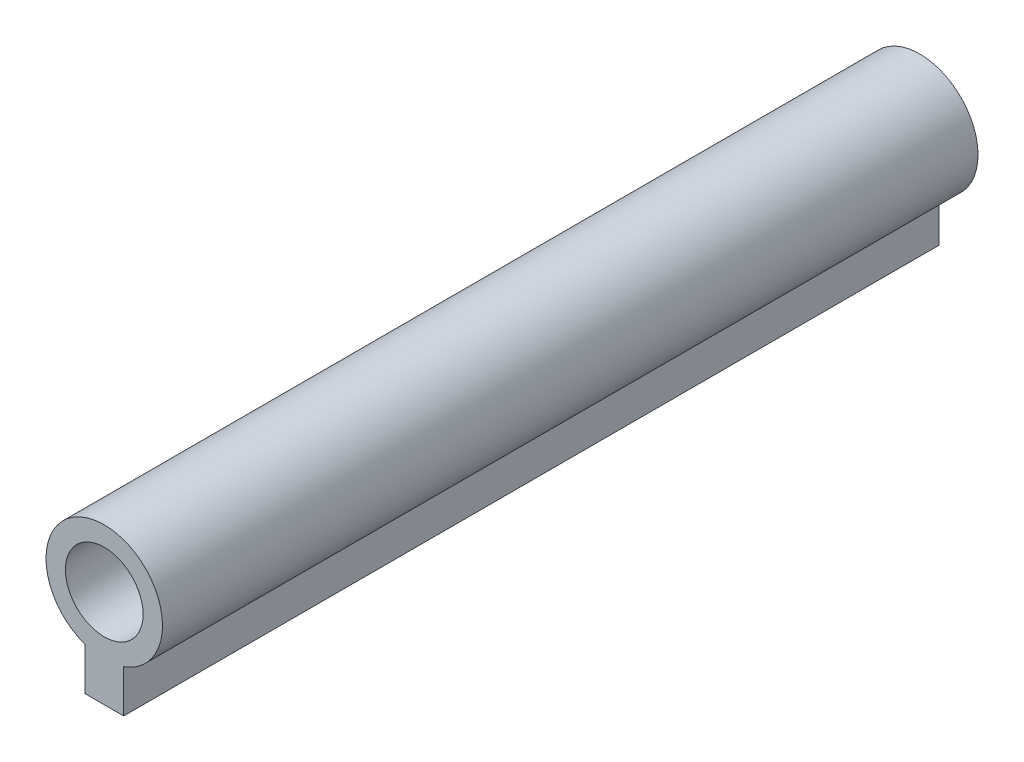
from build123d import *

# Parameters (mm, degrees)
SKETCH1_R               = 5
BOSS_EXTRUDE1_DEPTH     = 21
CUT_EXTRUDE1_DEPTH      = 23.158519806
CUT_EXTRUDE1_DEPTH_BACK = 23.158519806
SKETCH2_OUTSIDE_W       = 17.064
SKETCH2_OUTSIDE_H       = 17.064
SKETCH6_R               = 1
CUT_EXTRUDE4_DEPTH      = 6


with BuildPart() as part:
    # Sketch1 → Boss-Extrude1 (new body)
    with BuildSketch(Plane.XY):
        Circle(SKETCH1_R)
    extrude(amount=BOSS_EXTRUDE1_DEPTH)

    # Sketch2 outside → Cut-Extrude1 (cut, two sides: drawn at the far end of the back side and taken through both)
    with BuildSketch(Plane(origin=(0, 0, 0), x_dir=(-1, 0, 0), z_dir=(0, 0, -1)).offset(-CUT_EXTRUDE1_DEPTH_BACK)):
        Rectangle(SKETCH2_OUTSIDE_W, SKETCH2_OUTSIDE_H)
        with BuildLine():
            Line((-0.5, -1.414213562), (-0.5, -2.514213562))
            Line((-0.5, -2.514213562), (0.5, -2.514213562))
            Line((0.5, -2.514213562), (0.5, -1.414213562))
            ThreePointArc((0.5, -1.414213562), (0, 1.5), (-0.5, -1.414213562))
        make_face(mode=Mode.SUBTRACT)
    extrude(amount=CUT_EXTRUDE1_DEPTH + CUT_EXTRUDE1_DEPTH_BACK, mode=Mode.SUBTRACT)

    # Sketch6 → Cut-Extrude4 (cut)
    with BuildSketch(Plane.XY.offset(21)):
        Circle(SKETCH6_R)
    extrude(amount=-CUT_EXTRUDE4_DEPTH, mode=Mode.SUBTRACT)


solid = part.part
